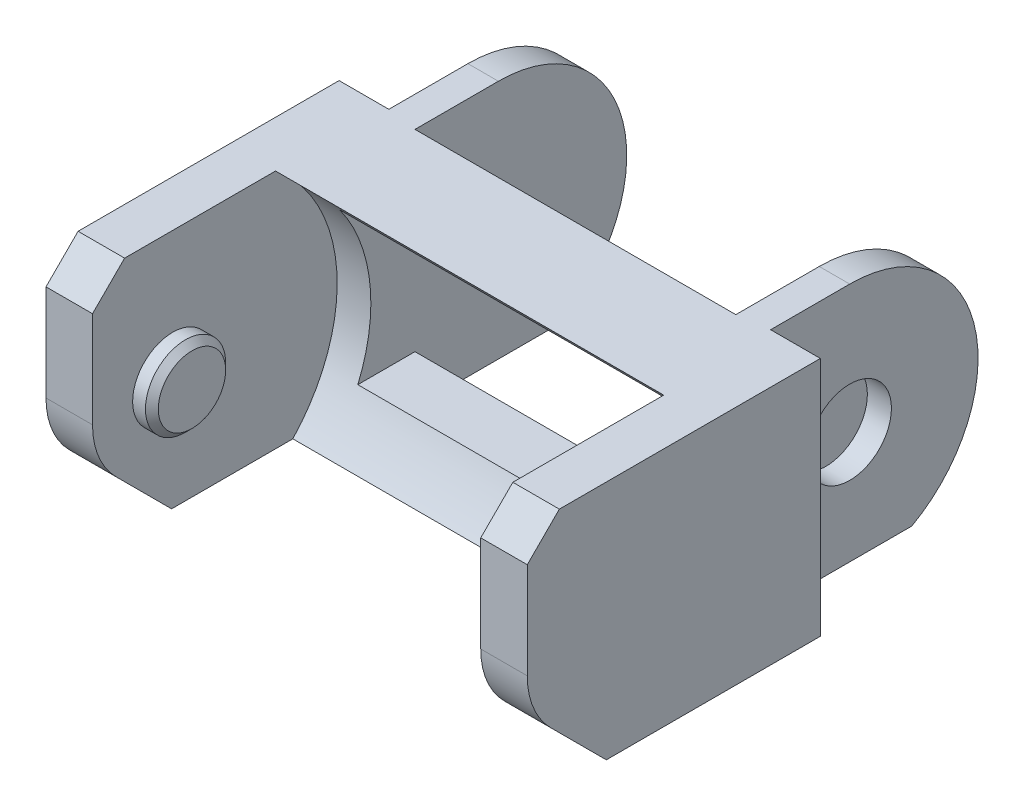
from build123d import *

# Parameters (mm, degrees)
SKETCH_1_W               = 30
SKETCH_1_H               = 15
EXTRUDE_1_DEPTH          = 18
CUT_EXTRUDE_1_REACH      = 28.843
SKETCH_2_W               = 20
SKETCH_2_H               = 10
CUT_EXTRUDE_2_REACH      = 29.668
SKETCH_3_W               = 20
SKETCH_3_H               = 12
CUT_EXTRUDE_5_DEPTH      = 22.1
CUT_EXTRUDE_5_DEPTH_BACK = 2.1
SKETCH_5_R               = 2.5
EXTRUDE_2_DEPTH          = 1.2
EXTRUDE_START            = 1.2
SKETCH_6_R               = 2.5
EXTRUDE_3_DEPTH          = 1.2
CHAMFER_1_SIZE           = 0.4
CUT_EXTRUDE_6_DEPTH      = 35.020684023
CUT_EXTRUDE_6_DEPTH_BACK = 35.020684023
CUT_EXTRUDE_7_DEPTH      = 35.020684023
CUT_EXTRUDE_7_DEPTH_BACK = 35.020684023
SKETCH_9_W               = 1.9
SKETCH_9_H               = 15
EXTRUDE_4_DEPTH          = 20
SKETCH_10_R              = 2.6
CUT_EXTRUDE_8_DEPTH      = 35.965796737
CUT_EXTRUDE_9_DEPTH      = 35.965796737
CUT_EXTRUDE_9_DEPTH_BACK = 35.965796737
EXTRUDE_START_2          = 0.4
SKETCH_15_R              = 2.6
EXTRUDE_6_DEPTH          = 0.4
SKETCH_16_R              = 2.6
EXTRUDE_7_DEPTH          = 0.4
CHAMFER_2_SIZE           = 2
SKETCH_17_W              = 3.1
SKETCH_17_H              = 15
EXTRUDE_8_DEPTH          = 0.27


with BuildPart() as part:
    # 草圖1 → 填料-伸長1 (new body)
    with BuildSketch(Plane.XY):
        with Locations((2.249045701, -2.44972067)):
            Rectangle(SKETCH_1_W, SKETCH_1_H)
    extrude(amount=EXTRUDE_1_DEPTH)

    # 草圖2 → 除料-伸長1 (cut, up to next)
    with BuildSketch(Plane.XY.offset(18), mode=Mode.PRIVATE) as cut_extrude_1_sk1:
        with Locations((2.249045701, -1.94972067)):
            Rectangle(SKETCH_2_W, SKETCH_2_H)
    cut_extrude_1_tool1 = extrude(cut_extrude_1_sk1.sketch, amount=-CUT_EXTRUDE_1_REACH, mode=Mode.PRIVATE) & part.part
    add(cut_extrude_1_tool1.solids().sort_by_distance((2.249046, -1.949721, 18))[0], mode=Mode.SUBTRACT)

    # 草圖3 → 除料-伸長2 (cut, up to next)
    with BuildSketch(Plane(origin=(0, -6.94972067, 0), x_dir=(1, 0, 0), z_dir=(0, 1, 0)), mode=Mode.PRIVATE) as cut_extrude_2_sk1:
        with Locations((2.249045701, -12)):
            Rectangle(SKETCH_3_W, SKETCH_3_H)
    cut_extrude_2_tool1 = extrude(cut_extrude_2_sk1.sketch, amount=-CUT_EXTRUDE_2_REACH, mode=Mode.PRIVATE) & part.part
    add(cut_extrude_2_tool1.solids().sort_by_distance((2.249046, -6.949721, 12))[0], mode=Mode.SUBTRACT)

    # 草圖4 → 除料-伸長5 (cut, two sides: drawn at the far end of the back side and taken through both)
    with BuildSketch(Plane(origin=(-7.750954299, 0, 0), x_dir=(0, 0, -1), z_dir=(1, 0, 0)).offset(-CUT_EXTRUDE_5_DEPTH_BACK)):
        with BuildLine():
            Line((-13, 7.30027933), (-13, 7.89449882))
            Line((-13, 7.89449882), (-18, 7.89449882))
            Line((-18, 7.89449882), (-18, 5.998044414))
            ThreePointArc((-18, 5.998044414), (-10.416600313, -12.868820733), (-13, 7.30027933))
        make_face()
    extrude(amount=CUT_EXTRUDE_5_DEPTH + CUT_EXTRUDE_5_DEPTH_BACK, mode=Mode.SUBTRACT)

    # 草圖5 → 填料-伸長2 (add)
    with BuildSketch(Plane.ZY.offset(-14.349045701)):
        with Locations((13, -2.94972067)):
            Circle(SKETCH_5_R)
    extrude(amount=EXTRUDE_2_DEPTH)

    # 草圖6 → 填料-伸長3 (add)
    with BuildSketch(Plane(origin=(-9.850954299, 0, 0), x_dir=(0, 0, -1), z_dir=(1, 0, 0)).offset(EXTRUDE_START)):
        with Locations((-13, -2.94972067)):
            Circle(SKETCH_6_R)
    extrude(amount=-EXTRUDE_3_DEPTH)

    # 導角1
    chamfer_1_edges = [part.edges().sort_by_distance(p)[0] for p in [
        (-8.650954299, -2.94972067, 15.5),
        (13.149045701, -2.94972067, 10.5),
    ]]
    chamfer(chamfer_1_edges, length=CHAMFER_1_SIZE)

    # 草圖7 → 除料-伸長6 (cut, two sides: drawn at the far end of the back side and taken through both)
    with BuildSketch(Plane(origin=(-9.850954299, 0, 0), x_dir=(0, 0, -1), z_dir=(1, 0, 0)).offset(-CUT_EXTRUDE_6_DEPTH_BACK)):
        Polygon((-18, -9.94972067), (-13.071067812, -9.94972067), (-18, -5.020788482), align=None)
    extrude(amount=CUT_EXTRUDE_6_DEPTH + CUT_EXTRUDE_6_DEPTH_BACK, mode=Mode.SUBTRACT)

    # 草圖8 → 除料-伸長7 (cut, two sides: drawn at the far end of the back side and taken through both)
    with BuildSketch(Plane(origin=(-9.850954299, 0, 0), x_dir=(0, 0, -1), z_dir=(1, 0, 0)).offset(-CUT_EXTRUDE_7_DEPTH_BACK)):
        with BuildLine():
            Line((-18, -2.94972067), (-18, -5.020788482))
            Line((-18, -5.020788482), (-16.535533871, -6.485254612))
            ThreePointArc((-16.535533871, -6.485254612), (-17.619397653, -4.863137855), (-18, -2.94972067))
        make_face()
    extrude(amount=CUT_EXTRUDE_7_DEPTH + CUT_EXTRUDE_7_DEPTH_BACK, mode=Mode.SUBTRACT)

    # 草圖9 → 填料-伸長4 (add)
    with BuildSketch(Plane(origin=(0, 0, 0), x_dir=(-1, 0, 0), z_dir=(0, 0, -1))):
        with Locations((-13.199045701, -2.44972067)):
            Rectangle(SKETCH_9_W, SKETCH_9_H)
        with Locations((8.700954299, -2.44972067)):
            Rectangle(SKETCH_9_W, SKETCH_9_H)
    extrude(amount=EXTRUDE_4_DEPTH)

    # 草圖10 → 除料-伸長8 (cut, through all)
    with BuildSketch(Plane(origin=(14.149045701, 0, 0), x_dir=(0, 0, -1), z_dir=(1, 0, 0))):
        with Locations((5.2, -2.94972067)):
            Circle(SKETCH_10_R)
    extrude(amount=-CUT_EXTRUDE_8_DEPTH, mode=Mode.SUBTRACT)

    # 草圖12 → 除料-伸長9 (cut, two sides: drawn at the far end of the back side and taken through both)
    with BuildSketch(Plane(origin=(14.149045701, 0, 0), x_dir=(0, 0, -1), z_dir=(1, 0, 0)).offset(-CUT_EXTRUDE_9_DEPTH_BACK)):
        with BuildLine():
            ThreePointArc((5.2, 5.05027933), (12.945966692, -0.94972067), (9.072983346, -9.94972067))
            Line((9.072983346, -9.94972067), (20, -9.94972067))
            Line((20, -9.94972067), (20, 5.05027933))
            Line((20, 5.05027933), (5.2, 5.05027933))
        make_face()
    extrude(amount=CUT_EXTRUDE_9_DEPTH + CUT_EXTRUDE_9_DEPTH_BACK, mode=Mode.SUBTRACT)

    # 草圖15 → 填料-伸長6 (add)
    with BuildSketch(Plane(origin=(12.249045701, 0, 0), x_dir=(0, 0, -1), z_dir=(1, 0, 0)).offset(EXTRUDE_START_2)):
        with Locations((5.2, -2.94972067)):
            Circle(SKETCH_15_R)
    extrude(amount=-EXTRUDE_6_DEPTH)

    # 草圖16 → 填料-伸長7 (add)
    with BuildSketch(Plane.ZY.offset(7.750954299)):
        with Locations((-5.2, -2.94972067)):
            Circle(SKETCH_16_R)
    extrude(amount=EXTRUDE_7_DEPTH)

    # 導角2
    chamfer_2_edges = [part.edges().sort_by_distance(p)[0] for p in [
        (15.799045701, 5.05027933, 18),
        (-11.300954299, 5.05027933, 18),
    ]]
    chamfer(chamfer_2_edges, length=CHAMFER_2_SIZE)

    # 草圖17 → 填料-伸長8 (add)
    with BuildSketch(Plane(origin=(0, 0, 0), x_dir=(-1, 0, 0), z_dir=(0, 0, -1))):
        with Locations((-15.699045701, -2.44972067)):
            Rectangle(SKETCH_17_W, SKETCH_17_H)
        with Locations((11.200954299, -2.44972067)):
            Rectangle(SKETCH_17_W, SKETCH_17_H)
    extrude(amount=EXTRUDE_8_DEPTH)


solid = part.part
